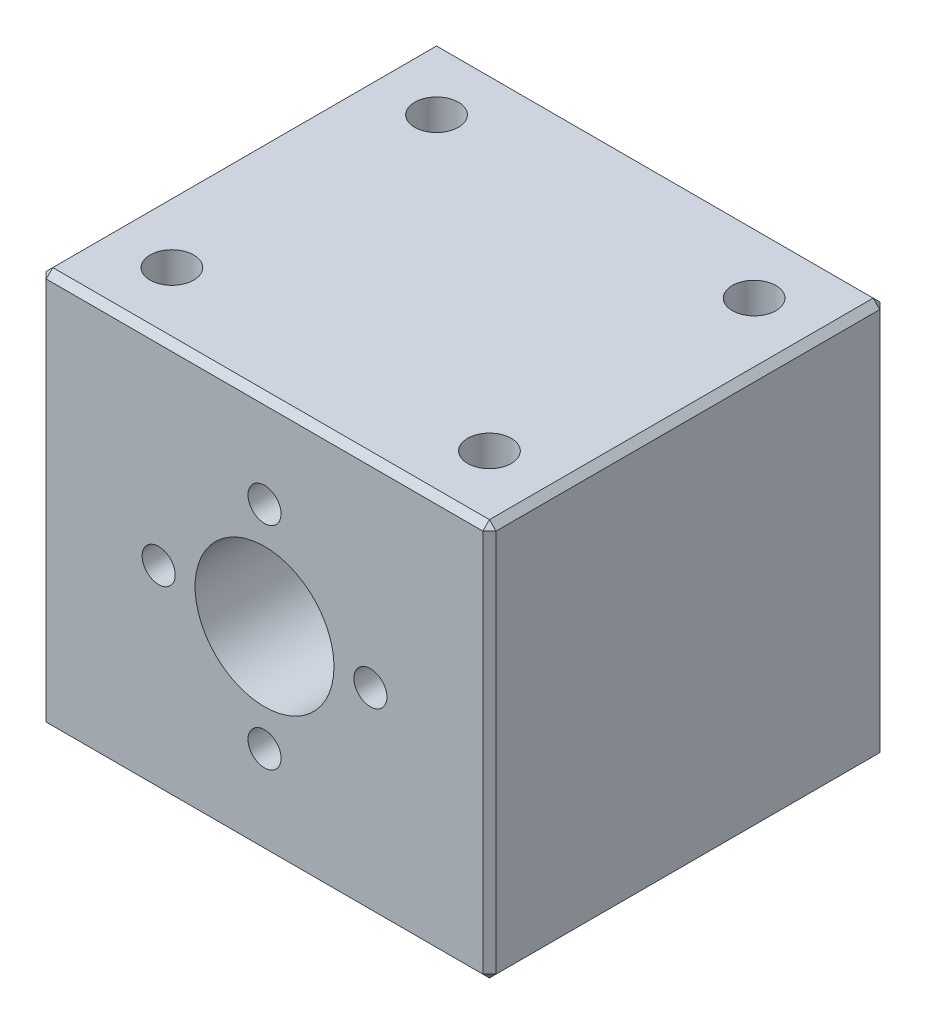
from build123d import *

# Parameters (mm, degrees)
SKETCH_1_W          = 34
SKETCH_1_H          = 30
EXTRUDE_1_DEPTH     = 15
SKETCH_3_R          = 5.25
CUT_EXTRUDE_1_DEPTH = 38.603191354
M3X0_5_1_D          = 2.5
M3X0_5_1_DEPTH      = 10
M3X0_5_1_TIP        = 0.751075774
M4X0_7_1_D          = 3.3
M4X0_7_1_DEPTH      = 20
M4X0_7_1_TIP        = 0.991420021
CHAMFER1_SIZE       = 0.5


with BuildPart() as part:
    # 草圖1 → 填料-伸長1 (new, symmetric)
    with BuildSketch(Plane.XY):
        Rectangle(SKETCH_1_W, SKETCH_1_H)
    extrude(amount=EXTRUDE_1_DEPTH, both=True)

    # 草圖3 → 除料-伸長1 (cut, through all)
    with BuildSketch(Plane.XY.offset(15)):
        Circle(SKETCH_3_R)
    extrude(amount=-CUT_EXTRUDE_1_DEPTH, mode=Mode.SUBTRACT)

    # M3x0.5 螺紋孔1
    with Locations(Plane.XY.offset(15)):
        with Locations((8, 0), (-8, 0), (0, 8), (0, -8)):
            Hole(M3X0_5_1_D / 2, depth=M3X0_5_1_DEPTH)
            with Locations((0, 0, -(M3X0_5_1_DEPTH + M3X0_5_1_TIP / 2))):  # 118° drill point
                Cone(0, M3X0_5_1_D / 2, M3X0_5_1_TIP, mode=Mode.SUBTRACT)

    # M4x0.7 螺紋孔1
    with Locations(Plane(origin=(0, 15, 0), x_dir=(1, 0, 0), z_dir=(0, 1, 0))):
        with Locations((12, -10), (-12, 10), (-12, -10), (12, 10)):
            Hole(M4X0_7_1_D / 2, depth=M4X0_7_1_DEPTH)
            with Locations((0, 0, -(M4X0_7_1_DEPTH + M4X0_7_1_TIP / 2))):  # 118° drill point
                Cone(0, M4X0_7_1_D / 2, M4X0_7_1_TIP, mode=Mode.SUBTRACT)

    # Chamfer1
    chamfer1_edges = [part.edges().sort_by_distance(p)[0] for p in [
        (-17, 15, 0),
        (-17, 0, 15),
        (-17, -15, 0),
        (-17, 0, -15),
        (17, -15, 0),
        (0, -15, 15),
        (17, 0, 15),
        (0, 15, 15),
        (17, 15, 0),
        (0, 15, -15),
        (17, 0, -15),
        (0, -15, -15),
    ]]
    chamfer(chamfer1_edges, length=CHAMFER1_SIZE)


solid = part.part
